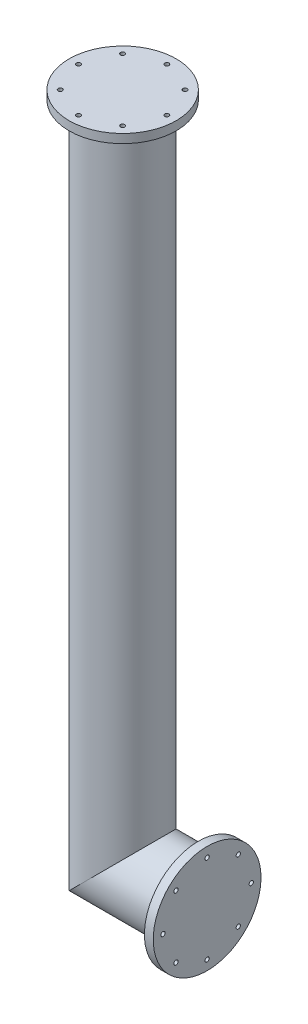
from build123d import *

# Parameters (mm, degrees)
CROQUIS1_R                                     = 42.75
SALIENTE_EXTRUIR1_DEPTH                        = 3.5
SALIENTE_EXTRUIR2_REACH                        = 181
CROQUIS3_R                                     = 30
CROQUIS3_R_2                                   = 25
SALIENTE_EXTRUIR3_REACH                        = 672.151
CROQUIS4_R                                     = 30
CROQUIS4_R_2                                   = 25
REFRENTADO_PARA_TORNILLO_CON_CABEZA_2_COUNT    = 2
REFRENTADO_PARA_TORNILLO_CON_CABEZA_2_PITCH    = 26.787840266
REFRENTADO_PARA_TORNILLO_CON_CABEZA_3_COUNT    = 2
REFRENTADO_PARA_TORNILLO_CON_CABEZA_3_PITCH    = 49.497474683
REFRENTADO_PARA_TORNILLO_CON_CABEZA_4_COUNT    = 2
REFRENTADO_PARA_TORNILLO_CON_CABEZA_4_PITCH    = 64.671567276
REFRENTADO_PARA_TORNILLO_CON_CABEZA_5_COUNT    = 2
REFRENTADO_PARA_TORNILLO_CON_CABEZA_5_PITCH    = 70
REFRENTADO_PARA_TORNILLO_CON_CABEZA_6_COUNT    = 2
REFRENTADO_PARA_TORNILLO_CON_CABEZA_6_PITCH    = 64.671567276
REFRENTADO_PARA_TORNILLO_CON_CABEZA_7_COUNT    = 2
REFRENTADO_PARA_TORNILLO_CON_CABEZA_7_PITCH    = 49.497474683
REFRENTADO_PARA_TORNILLO_CON_CABEZA_8_COUNT    = 2
REFRENTADO_PARA_TORNILLO_CON_CABEZA_8_PITCH    = 26.787840266
CROQUIS8_R                                     = 42.5
SALIENTE_EXTRUIR4_DEPTH                        = 7
REFRENTADO_PARA_TORNILLO_CON_CABEZA_9_AT_COUNT = 2
REFRENTADO_PARA_TORNILLO_CON_CABEZA_9_AT_PITCH = 26.787840266
REFRENTADO_PARA_TORNILLO_CON_CABEZA_10_COUNT   = 2
REFRENTADO_PARA_TORNILLO_CON_CABEZA_10_PITCH   = 49.497474683
REFRENTADO_PARA_TORNILLO_CON_CABEZA_11_COUNT   = 2
REFRENTADO_PARA_TORNILLO_CON_CABEZA_11_PITCH   = 64.671567276
REFRENTADO_PARA_TORNILLO_CON_CABEZA_12_COUNT   = 2
REFRENTADO_PARA_TORNILLO_CON_CABEZA_12_PITCH   = 70
REFRENTADO_PARA_TORNILLO_CON_CABEZA_13_COUNT   = 2
REFRENTADO_PARA_TORNILLO_CON_CABEZA_13_PITCH   = 64.671567276
REFRENTADO_PARA_TORNILLO_CON_CABEZA_14_COUNT   = 2
REFRENTADO_PARA_TORNILLO_CON_CABEZA_14_PITCH   = 49.497474683
REFRENTADO_PARA_TORNILLO_CON_CABEZA_15_COUNT   = 2
REFRENTADO_PARA_TORNILLO_CON_CABEZA_15_PITCH   = 26.787840266


with BuildPart() as part:
    # Croquis1 → Saliente-Extruir1 (new, symmetric)
    with BuildSketch(Plane(origin=(0, 0, 0), x_dir=(0, 0, -1), z_dir=(1, 0, 0))):
        Circle(CROQUIS1_R)
    extrude(amount=SALIENTE_EXTRUIR1_DEPTH, both=True)

    # Saliente-Extruir2: up to this plane
    saliente_extruir2_end = Plane(origin=(-63.5, 0, 0), z_dir=(-0.7071067811865489, 0.7071067811865461, 0))
    # Croquis3 → Saliente-Extruir2 (add, up to the surface)
    with BuildSketch(Plane.ZY.offset(3.5), mode=Mode.PRIVATE) as saliente_extruir2_sk1:
        Circle(CROQUIS3_R)
        Circle(CROQUIS3_R_2, mode=Mode.SUBTRACT)
    saliente_extruir2_tool1 = split(extrude(saliente_extruir2_sk1.sketch, amount=SALIENTE_EXTRUIR2_REACH, mode=Mode.PRIVATE), bisect_by=saliente_extruir2_end, keep=Keep.BOTH, mode=Mode.PRIVATE)
    add(saliente_extruir2_tool1.solids().sort_by_distance((-3.5, 0, -29.151472))[0])

    # Croquis7 → Refrentado para tornillo con cabeza tron (revolve, cut)
    with BuildSketch(Plane(origin=(-3.5, 35, 0), x_dir=(0, 0, 1), z_dir=(0, 1, 0))):
        Polygon((0, 0), (0, 7), (1.7, 7), (1.7, 2.4), (3.5, 2.4), (3.5, 0), align=None)
    refrentado_para_tornillo_con_cabeza_tron = revolve(axis=Axis((-9.85, 35, 0), (1, 0, 0)), mode=Mode.SUBTRACT)

    # Refrentado para tornillo con cabeza  2: Refrentado para tornillo con cabeza tron ×2
    with Locations(*[Vector(0, -0.3826834323650482, 0.9238795325113041) * (i * REFRENTADO_PARA_TORNILLO_CON_CABEZA_2_PITCH) for i in range(1, REFRENTADO_PARA_TORNILLO_CON_CABEZA_2_COUNT)]):
        add(refrentado_para_tornillo_con_cabeza_tron, mode=Mode.SUBTRACT)

    # Refrentado para tornillo con cabeza  3: Refrentado para tornillo con cabeza tron ×2
    with Locations(*[Vector(0, -0.7071067811865158, 0.7071067811865792) * (i * REFRENTADO_PARA_TORNILLO_CON_CABEZA_3_PITCH) for i in range(1, REFRENTADO_PARA_TORNILLO_CON_CABEZA_3_COUNT)]):
        add(refrentado_para_tornillo_con_cabeza_tron, mode=Mode.SUBTRACT)

    # Refrentado para tornillo con cabeza  4: Refrentado para tornillo con cabeza tron ×2
    with Locations(*[Vector(0, -0.9238795325112696, 0.3826834323651312) * (i * REFRENTADO_PARA_TORNILLO_CON_CABEZA_4_PITCH) for i in range(1, REFRENTADO_PARA_TORNILLO_CON_CABEZA_4_COUNT)]):
        add(refrentado_para_tornillo_con_cabeza_tron, mode=Mode.SUBTRACT)

    # Refrentado para tornillo con cabeza  5: Refrentado para tornillo con cabeza tron ×2
    with Locations(*[(0, -i * REFRENTADO_PARA_TORNILLO_CON_CABEZA_5_PITCH, 0) for i in range(1, REFRENTADO_PARA_TORNILLO_CON_CABEZA_5_COUNT)]):
        add(refrentado_para_tornillo_con_cabeza_tron, mode=Mode.SUBTRACT)

    # Refrentado para tornillo con cabeza  6: Refrentado para tornillo con cabeza tron ×2
    with Locations(*[Vector(0, -0.923879532511304, -0.38268343236504837) * (i * REFRENTADO_PARA_TORNILLO_CON_CABEZA_6_PITCH) for i in range(1, REFRENTADO_PARA_TORNILLO_CON_CABEZA_6_COUNT)]):
        add(refrentado_para_tornillo_con_cabeza_tron, mode=Mode.SUBTRACT)

    # Refrentado para tornillo con cabeza  7: Refrentado para tornillo con cabeza tron ×2
    with Locations(*[Vector(0, -0.7071067811865792, -0.7071067811865158) * (i * REFRENTADO_PARA_TORNILLO_CON_CABEZA_7_PITCH) for i in range(1, REFRENTADO_PARA_TORNILLO_CON_CABEZA_7_COUNT)]):
        add(refrentado_para_tornillo_con_cabeza_tron, mode=Mode.SUBTRACT)

    # Refrentado para tornillo con cabeza  8: Refrentado para tornillo con cabeza tron ×2
    with Locations(*[Vector(0, -0.3826834323651309, -0.9238795325112698) * (i * REFRENTADO_PARA_TORNILLO_CON_CABEZA_8_PITCH) for i in range(1, REFRENTADO_PARA_TORNILLO_CON_CABEZA_8_COUNT)]):
        add(refrentado_para_tornillo_con_cabeza_tron, mode=Mode.SUBTRACT)


with BuildPart() as body_2:
    # Saliente-Extruir3: up to this plane
    saliente_extruir3_end = Plane(origin=(-63.5, 0, 0), z_dir=(-0.7071067811865489, 0.7071067811865461, 0))
    # Croquis4 → Saliente-Extruir3 (new, up to the surface)
    with BuildSketch(Plane(origin=(0, 522, 0), x_dir=(1, 0, 0), z_dir=(0, 1, 0)), mode=Mode.PRIVATE) as saliente_extruir3_sk1:
        with Locations((-63.5, 0)):
            Circle(CROQUIS4_R)
        with Locations((-63.5, 0)):
            Circle(CROQUIS4_R_2, mode=Mode.SUBTRACT)
    saliente_extruir3_tool1 = split(extrude(saliente_extruir3_sk1.sketch, amount=-SALIENTE_EXTRUIR3_REACH, mode=Mode.PRIVATE), bisect_by=saliente_extruir3_end, keep=Keep.BOTH, mode=Mode.PRIVATE)
    add(saliente_extruir3_tool1.solids().sort_by_distance((-92.651472, 522, 0))[0])

    # Croquis8 → Saliente-Extruir4 (add)
    with BuildSketch(Plane(origin=(0, 522, 0), x_dir=(1, 0, 0), z_dir=(0, 1, 0))):
        with Locations((-63.5, 0)):
            Circle(CROQUIS8_R)
    extrude(amount=SALIENTE_EXTRUIR4_DEPTH)

    # Croquis10 → Refrentado para tornillo con cabeza  9 (revolve, cut)
    with BuildSketch(Plane(origin=(-63.5, 522, 35), x_dir=(0, 0, -1), z_dir=(1, 0, 0))):
        Polygon((0, 0), (0, 7.001), (1.7, 7.001), (1.7, 2.4), (3.5, 2.4), (3.5, 0), align=None)
    refrentado_para_tornillo_con_cabeza_9 = revolve(axis=Axis((-63.5, 515.65, 35), (0, 1, 0)), mode=Mode.SUBTRACT)

    # Refrentado para tornillo con cabeza 9 at: Refrentado para tornillo con cabeza  9 ×2
    with Locations(*[Vector(0.9238795325112872, 0, -0.3826834323650887) * (i * REFRENTADO_PARA_TORNILLO_CON_CABEZA_9_AT_PITCH) for i in range(1, REFRENTADO_PARA_TORNILLO_CON_CABEZA_9_AT_COUNT)]):
        add(refrentado_para_tornillo_con_cabeza_9, mode=Mode.SUBTRACT)

    # Refrentado para tornillo con cabeza  10: Refrentado para tornillo con cabeza  9 ×2
    with Locations(*[Vector(0.7071067811865482, 0, -0.7071067811865469) * (i * REFRENTADO_PARA_TORNILLO_CON_CABEZA_10_PITCH) for i in range(1, REFRENTADO_PARA_TORNILLO_CON_CABEZA_10_COUNT)]):
        add(refrentado_para_tornillo_con_cabeza_9, mode=Mode.SUBTRACT)

    # Refrentado para tornillo con cabeza  11: Refrentado para tornillo con cabeza  9 ×2
    with Locations(*[Vector(0.3826834323650904, 0, -0.9238795325112866) * (i * REFRENTADO_PARA_TORNILLO_CON_CABEZA_11_PITCH) for i in range(1, REFRENTADO_PARA_TORNILLO_CON_CABEZA_11_COUNT)]):
        add(refrentado_para_tornillo_con_cabeza_9, mode=Mode.SUBTRACT)

    # Refrentado para tornillo con cabeza  12: Refrentado para tornillo con cabeza  9 ×2
    with Locations(*[(0, 0, -i * REFRENTADO_PARA_TORNILLO_CON_CABEZA_12_PITCH) for i in range(1, REFRENTADO_PARA_TORNILLO_CON_CABEZA_12_COUNT)]):
        add(refrentado_para_tornillo_con_cabeza_9, mode=Mode.SUBTRACT)

    # Refrentado para tornillo con cabeza  13: Refrentado para tornillo con cabeza  9 ×2
    with Locations(*[Vector(-0.382683432365089, 0, -0.9238795325112871) * (i * REFRENTADO_PARA_TORNILLO_CON_CABEZA_13_PITCH) for i in range(1, REFRENTADO_PARA_TORNILLO_CON_CABEZA_13_COUNT)]):
        add(refrentado_para_tornillo_con_cabeza_9, mode=Mode.SUBTRACT)

    # Refrentado para tornillo con cabeza  14: Refrentado para tornillo con cabeza  9 ×2
    with Locations(*[Vector(-0.707106781186547, 0, -0.7071067811865481) * (i * REFRENTADO_PARA_TORNILLO_CON_CABEZA_14_PITCH) for i in range(1, REFRENTADO_PARA_TORNILLO_CON_CABEZA_14_COUNT)]):
        add(refrentado_para_tornillo_con_cabeza_9, mode=Mode.SUBTRACT)

    # Refrentado para tornillo con cabeza  15: Refrentado para tornillo con cabeza  9 ×2
    with Locations(*[Vector(-0.9238795325112865, 0, -0.3826834323650904) * (i * REFRENTADO_PARA_TORNILLO_CON_CABEZA_15_PITCH) for i in range(1, REFRENTADO_PARA_TORNILLO_CON_CABEZA_15_COUNT)]):
        add(refrentado_para_tornillo_con_cabeza_9, mode=Mode.SUBTRACT)


solid = Compound([part.part, body_2.part])
